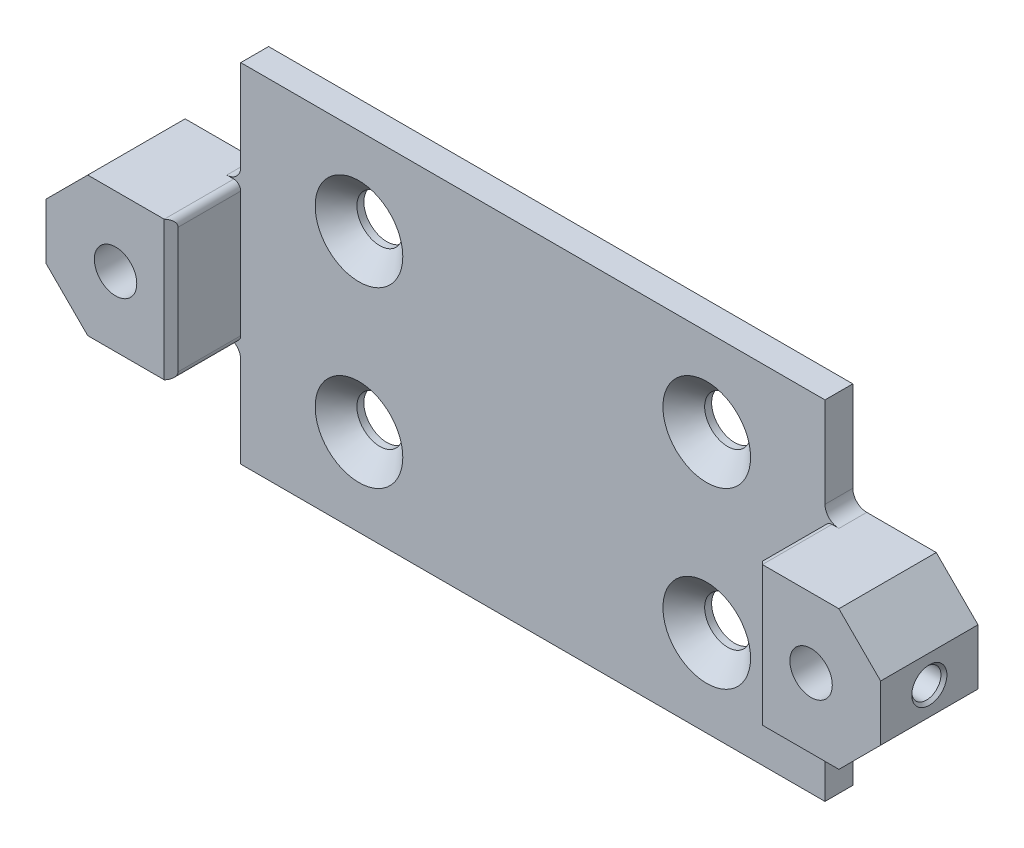
from build123d import *

# Parameters (mm, degrees)
BOSS_EXTRUDE1_DEPTH                          = 4
CSK_FOR_M6_COUNTERSUNK_FLAT_HEAD_SCR_2_COUNT = 2
CSK_FOR_M6_COUNTERSUNK_FLAT_HEAD_SCR_2_PITCH = 25
CSK_FOR_M6_COUNTERSUNK_FLAT_HEAD_SCR_3_COUNT = 2
CSK_FOR_M6_COUNTERSUNK_FLAT_HEAD_SCR_3_PITCH = 55.901699437
CSK_FOR_M6_COUNTERSUNK_FLAT_HEAD_SCR_4_COUNT = 2
CSK_FOR_M6_COUNTERSUNK_FLAT_HEAD_SCR_4_PITCH = 50
SKETCH11_W                                   = 18
SKETCH11_H                                   = 20
BOSS_EXTRUDE4_DEPTH                          = 10
CHAMFER1_SIZE                                = 6
CUT_EXTRUDE5_REACH                           = 68.491
SKETCH12_R                                   = 3.05
FILLET2_R                                    = 2
CHAMFER2_SIZE                                = 1
FILLET3_R                                    = 1


# Read off the part's stored shape, not the designer's step: M5 Tapped Hole1
with BuildPart() as part:
    # Sketch1 → Boss-Extrude1 (new body)
    with BuildSketch(Plane.XY):
        Polygon((42, -25), (-42, -25), (-42, -10), (-60, -10), (-60, 10), (-42, 10), (-42, 25), (42, 25), (42, 10), (60, 10), (60, -10), (42, -10), align=None)
    extrude(amount=BOSS_EXTRUDE1_DEPTH)

    # Sketch10 → CSK for M6 Countersunk Flat Head Screw3 (revolve, cut)
    with BuildSketch(Plane(origin=(25, 12.5, 4), x_dir=(0, -1, 0), z_dir=(1, 0, 0))):
        Polygon((0, 0), (0, 4), (3.3, 4), (3.3, 3), (6.3, 0), align=None)
    csk_for_m6_countersunk_flat_head_screw3 = revolve(axis=Axis((25, 12.5, 10.35), (0, 0, -1)), mode=Mode.SUBTRACT)

    # CSK for M6 Countersunk Flat Head Scr 2: CSK for M6 Countersunk Flat Head Screw3 ×2
    with Locations(*[(0, -i * CSK_FOR_M6_COUNTERSUNK_FLAT_HEAD_SCR_2_PITCH, 0) for i in range(1, CSK_FOR_M6_COUNTERSUNK_FLAT_HEAD_SCR_2_COUNT)]):
        add(csk_for_m6_countersunk_flat_head_screw3, mode=Mode.SUBTRACT)

    # CSK for M6 Countersunk Flat Head Scr 3: CSK for M6 Countersunk Flat Head Screw3 ×2
    with Locations(*[Vector(-0.894427190999916, -0.447213595499958, 0) * (i * CSK_FOR_M6_COUNTERSUNK_FLAT_HEAD_SCR_3_PITCH) for i in range(1, CSK_FOR_M6_COUNTERSUNK_FLAT_HEAD_SCR_3_COUNT)]):
        add(csk_for_m6_countersunk_flat_head_screw3, mode=Mode.SUBTRACT)

    # CSK for M6 Countersunk Flat Head Scr 4: CSK for M6 Countersunk Flat Head Screw3 ×2
    with Locations(*[(-i * CSK_FOR_M6_COUNTERSUNK_FLAT_HEAD_SCR_4_PITCH, 0, 0) for i in range(1, CSK_FOR_M6_COUNTERSUNK_FLAT_HEAD_SCR_4_COUNT)]):
        add(csk_for_m6_countersunk_flat_head_screw3, mode=Mode.SUBTRACT)

    # Sketch11 → Boss-Extrude4 (add)
    with BuildSketch(Plane.XY.offset(4)):
        with Locations((51, 0)):
            Rectangle(SKETCH11_W, SKETCH11_H)
        with Locations((-51, 0)):
            Rectangle(SKETCH11_W, SKETCH11_H)
    extrude(amount=BOSS_EXTRUDE4_DEPTH)

    # Chamfer1
    chamfer1_edges = [part.edges().sort_by_distance(p)[0] for p in [
        (60, 10, 7),
        (60, -10, 7),
        (-60, -10, 7),
        (-60, 10, 7),
    ]]
    chamfer(chamfer1_edges, length=CHAMFER1_SIZE)

    # Sketch12 → Cut-Extrude5 (cut, up to next)
    with BuildSketch(Plane.XY.offset(14), mode=Mode.PRIVATE) as cut_extrude5_sk1:
        with Locations((50, 0)):
            Circle(SKETCH12_R)
    cut_extrude5_tool1 = extrude(cut_extrude5_sk1.sketch, amount=-CUT_EXTRUDE5_REACH, mode=Mode.PRIVATE) & part.part
    # Sketch12 → Cut-Extrude5 (cut, up to next)
    with BuildSketch(Plane.XY.offset(14), mode=Mode.PRIVATE) as cut_extrude5_sk2:
        with Locations((-50, 0)):
            Circle(SKETCH12_R)
    cut_extrude5_tool2 = extrude(cut_extrude5_sk2.sketch, amount=-CUT_EXTRUDE5_REACH, mode=Mode.PRIVATE) & part.part
    add(cut_extrude5_tool1.solids().sort_by_distance((50, 0, 14))[0], mode=Mode.SUBTRACT)
    add(cut_extrude5_tool2.solids().sort_by_distance((-50, 0, 14))[0], mode=Mode.SUBTRACT)

    # Fillet2
    fillet2_edges = [part.edges().sort_by_distance(p)[0] for p in [
        (42, 10, 2),
        (42, -10, 2),
        (-42, -10, 2),
        (-42, 10, 2),
    ]]
    fillet(fillet2_edges, radius=FILLET2_R)

    # Chamfer2
    chamfer2_edges = [part.edges().sort_by_distance(p)[0] for p in [
        (42, 0, 14),
        (-42, 0, 14),
    ]]
    chamfer(chamfer2_edges, length=CHAMFER2_SIZE)

    # Fillet3
    fillet3_edges = [part.edges().sort_by_distance(p)[0] for p in [
        (42, 10, 8.5),
        (42, -10, 8.5),
        (-42, 10, 8.5),
        (-42, -10, 8.5),
    ]]
    fillet(fillet3_edges, radius=FILLET3_R)

    # M5 Tapped Hole1 outline → M5 Tapped Hole1 (revolve, cut)
    with BuildSketch(Plane.YX.offset(-7)):
        Polygon((2.1, -59.575), (2.1, -52.211448723), (0, -52.211448723), (0, -60), (2.525, -60), align=None)
        Polygon((0, 52.211448731), (2.1, 52.211448731), (2.1, 59.575), (2.525, 60), (0, 60), align=None)
    revolve(axis=Axis((0, 0, 7), (1, 0, 0)), mode=Mode.SUBTRACT)


solid = part.part
